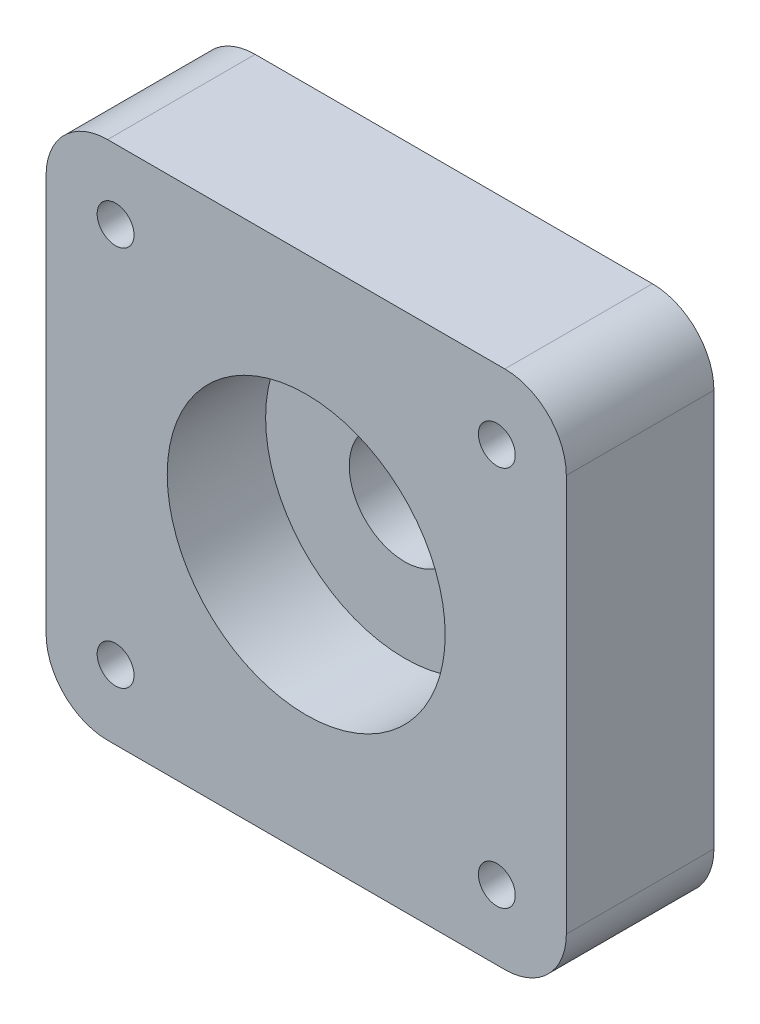
from build123d import *

# Parameters (mm, degrees)
CROQUIS1_W              = 42.3
CROQUIS1_H              = 42.3
CROQUIS1_R              = 1.5
SALIENTE_EXTRUIR1_DEPTH = 6
REDONDEO1_R             = 5
CROQUIS2_R              = 11.3
CORTAR_EXTRUIR1_DEPTH   = 8
CROQUIS3_R              = 4.5
CORTAR_EXTRUIR2_DEPTH   = 10


with BuildPart() as part:
    # Croquis1 → Saliente-Extruir1 (new, symmetric)
    with BuildSketch(Plane.XY):
        Rectangle(CROQUIS1_W, CROQUIS1_H)
        with Locations((-15.5, 15.5)):
            Circle(CROQUIS1_R, mode=Mode.SUBTRACT)
        with Locations((-15.5, -15.5)):
            Circle(CROQUIS1_R, mode=Mode.SUBTRACT)
        with Locations((15.5, -15.5)):
            Circle(CROQUIS1_R, mode=Mode.SUBTRACT)
        with Locations((15.5, 15.5)):
            Circle(CROQUIS1_R, mode=Mode.SUBTRACT)
    extrude(amount=SALIENTE_EXTRUIR1_DEPTH, both=True)

    # Redondeo1
    redondeo1_edges = [part.edges().sort_by_distance(p)[0] for p in [
        (-21.15, 21.15, 0),
        (-21.15, -21.15, 0),
        (21.15, -21.15, 0),
        (21.15, 21.15, 0),
    ]]
    fillet(redondeo1_edges, radius=REDONDEO1_R)

    # Croquis2 → Cortar-Extruir1 (cut)
    with BuildSketch(Plane.XY.offset(6)):
        Circle(CROQUIS2_R)
    extrude(amount=-CORTAR_EXTRUIR1_DEPTH, mode=Mode.SUBTRACT)

    # Croquis3 → Cortar-Extruir2 (cut)
    with BuildSketch(Plane(origin=(0, 0, -6), x_dir=(-1, 0, 0), z_dir=(0, 0, -1))):
        Circle(CROQUIS3_R)
    extrude(amount=-CORTAR_EXTRUIR2_DEPTH, mode=Mode.SUBTRACT)


solid = part.part
